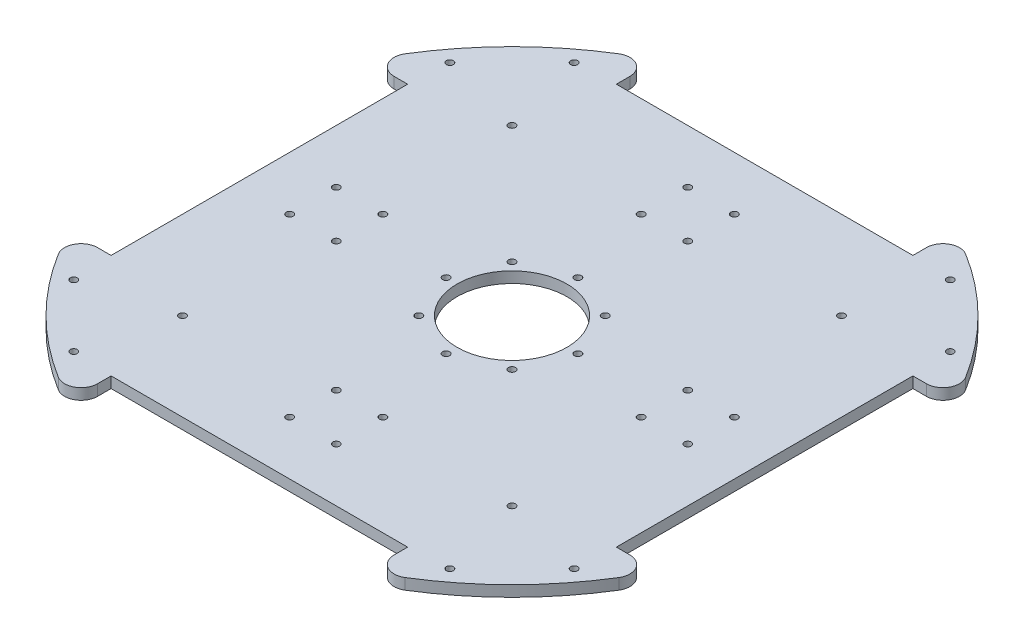
from build123d import *

# Parameters (mm, degrees)
BOSS_EXTRUDE1_DEPTH     = 5
FILLET1_R               = 7.5
CUT_EXTRUDE2_DEPTH      = 183.030179489
CUT_EXTRUDE2_DEPTH_BACK = 183.030179489
SKETCH3_R               = 1.6
CUT_EXTRUDE3_DEPTH      = 183.030179489
CUT_EXTRUDE3_DEPTH_BACK = 183.030179489
SKETCH4_R               = 25
SKETCH4_R_2             = 1.6
CUT_EXTRUDE4_DEPTH      = 183.030179489
CUT_EXTRUDE4_DEPTH_BACK = 183.030179489
SKETCH5_R               = 1.6
CUT_EXTRUDE5_DEPTH      = 183.030179489
CUT_EXTRUDE5_DEPTH_BACK = 183.030179489
SKETCH6_R               = 1.6


with BuildPart() as part:
    # Sketch1 → Boss-Extrude1 (new body)
    with BuildSketch(Plane(origin=(0, 0, 0), x_dir=(1, 0, 0), z_dir=(0, 1, 0))):
        with BuildLine():
            Line((115, 67.5), (133.954283246, 67.5))
            ThreePointArc((133.954283246, 67.5), (106.066017178, 106.066017178), (67.5, 133.954283246))
            Line((67.5, 133.954283246), (67.5, 115))
            Line((67.5, 115), (-67.5, 115))
            Line((-67.5, 115), (-67.5, 133.954283246))
            ThreePointArc((-67.5, 133.954283246), (-106.066017178, 106.066017178), (-133.954283246, 67.5))
            Line((-133.954283246, 67.5), (-115, 67.5))
            Line((-115, 67.5), (-115, -67.5))
            Line((-115, -67.5), (-133.954283246, -67.5))
            ThreePointArc((-133.954283246, -67.5), (-106.066017178, -106.066017178), (-67.5, -133.954283246))
            Line((-67.5, -133.954283246), (-67.5, -115))
            Line((-67.5, -115), (67.5, -115))
            Line((67.5, -115), (67.5, -133.954283246))
            ThreePointArc((67.5, -133.954283246), (106.066017178, -106.066017178), (133.954283246, -67.5))
            Line((133.954283246, -67.5), (115, -67.5))
            Line((115, -67.5), (115, 67.5))
        make_face()
    extrude(amount=BOSS_EXTRUDE1_DEPTH)

    # Fillet1
    fillet1_edges = [part.edges().sort_by_distance(p)[0] for p in [
        (-133.954283246, 2.5, 67.5),
        (-133.954283246, 2.5, -67.5),
        (-67.5, 2.5, -133.954283246),
        (67.5, 2.5, -133.954283246),
        (133.954283246, 2.5, -67.5),
        (133.954283246, 2.5, 67.5),
        (67.5, 2.5, 133.954283246),
        (-67.5, 2.5, 133.954283246),
    ]]
    fillet(fillet1_edges, radius=FILLET1_R)

    # Sketch3 → Cut-Extrude2 (cut, two sides: drawn at the far end of the back side and taken through both)
    with BuildSketch(Plane(origin=(0, 5, 0), x_dir=(1, 0, 0), z_dir=(0, 1, 0)).offset(-CUT_EXTRUDE2_DEPTH_BACK)):
        with Locations((-10.606601718, -90.606601718)):
            Circle(SKETCH3_R)
        with Locations((-10.606601718, -69.393398282)):
            Circle(SKETCH3_R)
        with Locations((10.606601718, -69.393398282)):
            Circle(SKETCH3_R)
        with Locations((10.606601718, -90.606601718)):
            Circle(SKETCH3_R)
        with Locations((-69.393398282, 10.606601718)):
            Circle(SKETCH3_R)
        with Locations((-69.393398282, -10.606601718)):
            Circle(SKETCH3_R)
        with Locations((-90.606601718, -10.606601718)):
            Circle(SKETCH3_R)
        with Locations((-90.606601718, 10.606601718)):
            Circle(SKETCH3_R)
        with Locations((10.606601718, 69.393398282)):
            Circle(SKETCH3_R)
        with Locations((-10.606601718, 69.393398282)):
            Circle(SKETCH3_R)
        with Locations((-10.606601718, 90.606601718)):
            Circle(SKETCH3_R)
        with Locations((10.606601718, 90.606601718)):
            Circle(SKETCH3_R)
        with Locations((69.393398282, -10.606601718)):
            Circle(SKETCH3_R)
        with Locations((69.393398282, 10.606601718)):
            Circle(SKETCH3_R)
        with Locations((90.606601718, 10.606601718)):
            Circle(SKETCH3_R)
        with Locations((90.606601718, -10.606601718)):
            Circle(SKETCH3_R)
    extrude(amount=CUT_EXTRUDE2_DEPTH + CUT_EXTRUDE2_DEPTH_BACK, mode=Mode.SUBTRACT)

    # Sketch4 → Cut-Extrude3 (cut, two sides: drawn at the far end of the back side and taken through both)
    with BuildSketch(Plane(origin=(0, 5, 0), x_dir=(1, 0, 0), z_dir=(0, 1, 0)).offset(-CUT_EXTRUDE3_DEPTH_BACK)):
        Circle(SKETCH4_R)
        with Locations((0, 30)):
            Circle(SKETCH4_R_2)
        with Locations((21.213203436, 21.213203436)):
            Circle(SKETCH4_R_2)
        with Locations((30, 0)):
            Circle(SKETCH4_R_2)
        with Locations((21.213203436, -21.213203436)):
            Circle(SKETCH4_R_2)
        with Locations((0, -30)):
            Circle(SKETCH4_R_2)
        with Locations((-21.213203436, -21.213203436)):
            Circle(SKETCH4_R_2)
        with Locations((-30, 0)):
            Circle(SKETCH4_R_2)
        with Locations((-21.213203436, 21.213203436)):
            Circle(SKETCH4_R_2)
    extrude(amount=CUT_EXTRUDE3_DEPTH + CUT_EXTRUDE3_DEPTH_BACK, mode=Mode.SUBTRACT)

    # Sketch5 → Cut-Extrude4 (cut, two sides: drawn at the far end of the back side and taken through both)
    with BuildSketch(Plane(origin=(0, 5, 0), x_dir=(1, 0, 0), z_dir=(0, 1, 0)).offset(-CUT_EXTRUDE4_DEPTH_BACK)):
        with Locations((75, -75)):
            Circle(SKETCH5_R)
        with Locations((-75, -75)):
            Circle(SKETCH5_R)
        with Locations((75, 75)):
            Circle(SKETCH5_R)
        with Locations((-75, 75)):
            Circle(SKETCH5_R)
    extrude(amount=CUT_EXTRUDE4_DEPTH + CUT_EXTRUDE4_DEPTH_BACK, mode=Mode.SUBTRACT)

    # Sketch6 → Cut-Extrude5 (cut, two sides: drawn at the far end of the back side and taken through both)
    with BuildSketch(Plane(origin=(0, 5, 0), x_dir=(1, 0, 0), z_dir=(0, 1, 0)).offset(-CUT_EXTRUDE5_DEPTH_BACK)):
        with Locations((-113.890872965, -85.606601718)):
            Circle(SKETCH6_R)
        with Locations((-85.606601718, -113.890872965)):
            Circle(SKETCH6_R)
        with Locations((-113.890872965, 85.606601718)):
            Circle(SKETCH6_R)
        with Locations((-85.606601718, 113.890872965)):
            Circle(SKETCH6_R)
        with Locations((85.606601718, 113.890872965)):
            Circle(SKETCH6_R)
        with Locations((113.890872965, 85.606601718)):
            Circle(SKETCH6_R)
        with Locations((113.890872965, -85.606601718)):
            Circle(SKETCH6_R)
        with Locations((85.606601718, -113.890872965)):
            Circle(SKETCH6_R)
    extrude(amount=CUT_EXTRUDE5_DEPTH + CUT_EXTRUDE5_DEPTH_BACK, mode=Mode.SUBTRACT)


solid = part.part
